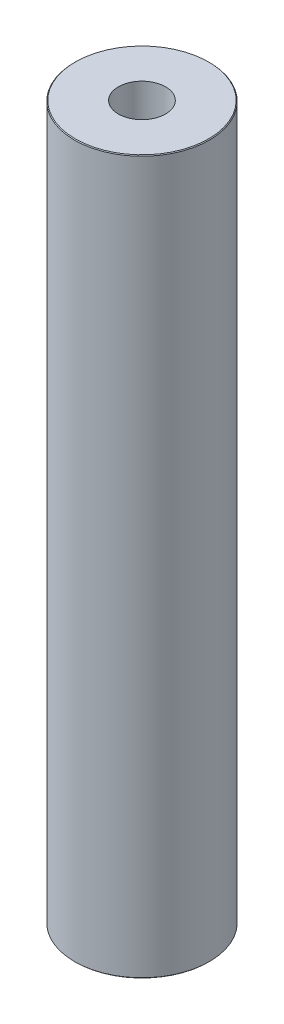
from build123d import *

# Parameters (mm, degrees)
SKETCH1_R           = 42.5
BOSS_EXTRUDE1_DEPTH = 449.67329934
SKETCH2_R           = 14.894380749
CUT_EXTRUDE1_DEPTH  = 454.67232243
CHAMFER1_SIZE       = 0.466639487


with BuildPart() as part:
    # Sketch1 → Boss-Extrude1 (new body)
    with BuildSketch(Plane(origin=(0, 0, 0), x_dir=(1, 0, 0), z_dir=(0, 1, 0))):
        Circle(SKETCH1_R)
    extrude(amount=BOSS_EXTRUDE1_DEPTH)

    # Sketch2 → Cut-Extrude1 (cut, through all)
    with BuildSketch(Plane(origin=(0, 0, 0), x_dir=(1, 0, 0), z_dir=(0, 1, 0))):
        Circle(SKETCH2_R)
    extrude(amount=CUT_EXTRUDE1_DEPTH, mode=Mode.SUBTRACT)

    # Chamfer1
    chamfer1_edges = [part.edges().sort_by_distance(p)[0] for p in [
        (-42.5, 449.67329934, 0),
        (-42.5, 0, 0),
    ]]
    chamfer(chamfer1_edges, length=CHAMFER1_SIZE)


solid = part.part
